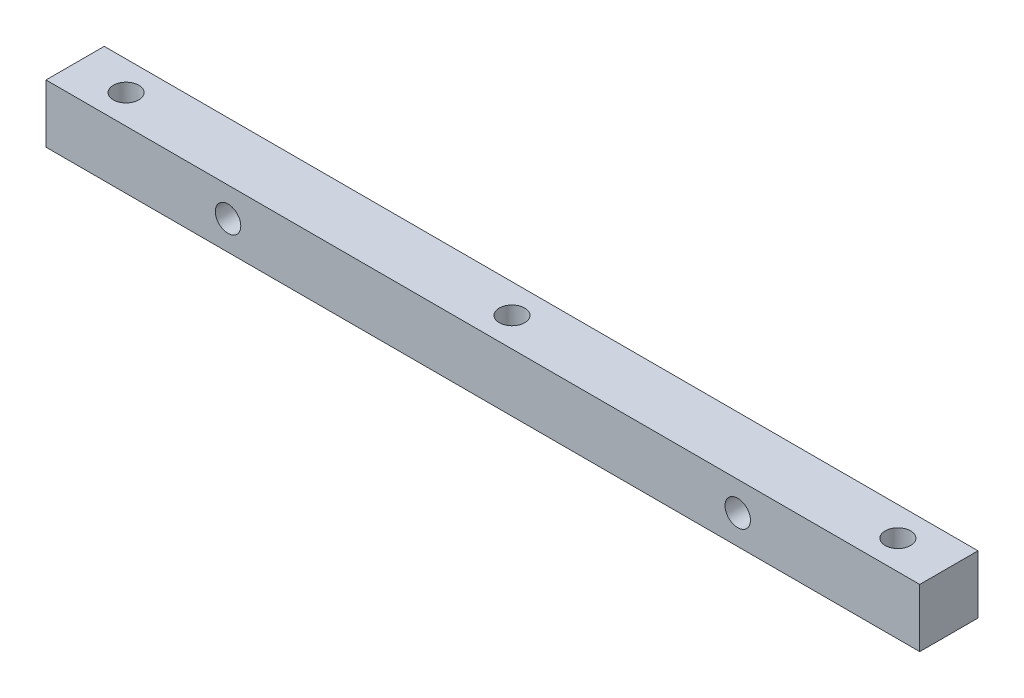
from build123d import *

# Parameters (mm, degrees)
SKIZZE1_W                       = 120
SKIZZE1_H                       = 8
SKIZZE1_R                       = 1.75
AUFSATZ_LINEAR_AUSTRAGEN1_DEPTH = 8
SKIZZE2_R                       = 1.75
SCHNITT_LINEAR_AUSTRAGEN1_DEPTH = 62.05735009


with BuildPart() as part:
    # Skizze1 → Aufsatz-Linear austragen1 (new body)
    with BuildSketch(Plane.XY):
        Rectangle(SKIZZE1_W, SKIZZE1_H)
        with Locations((-35, 0)):
            Circle(SKIZZE1_R, mode=Mode.SUBTRACT)
        with Locations((35, 0)):
            Circle(SKIZZE1_R, mode=Mode.SUBTRACT)
    extrude(amount=AUFSATZ_LINEAR_AUSTRAGEN1_DEPTH)

    # Skizze2 → Schnitt-Linear austragen1 (cut, through all)
    with BuildSketch(Plane(origin=(0, 4, 0), x_dir=(1, 0, 0), z_dir=(0, 1, 0))):
        with Locations((53, -4)):
            Circle(SKIZZE2_R)
        with Locations((-53, -4)):
            Circle(SKIZZE2_R)
        with Locations((0, -4)):
            Circle(SKIZZE2_R)
    extrude(amount=-SCHNITT_LINEAR_AUSTRAGEN1_DEPTH, mode=Mode.SUBTRACT)


solid = part.part
